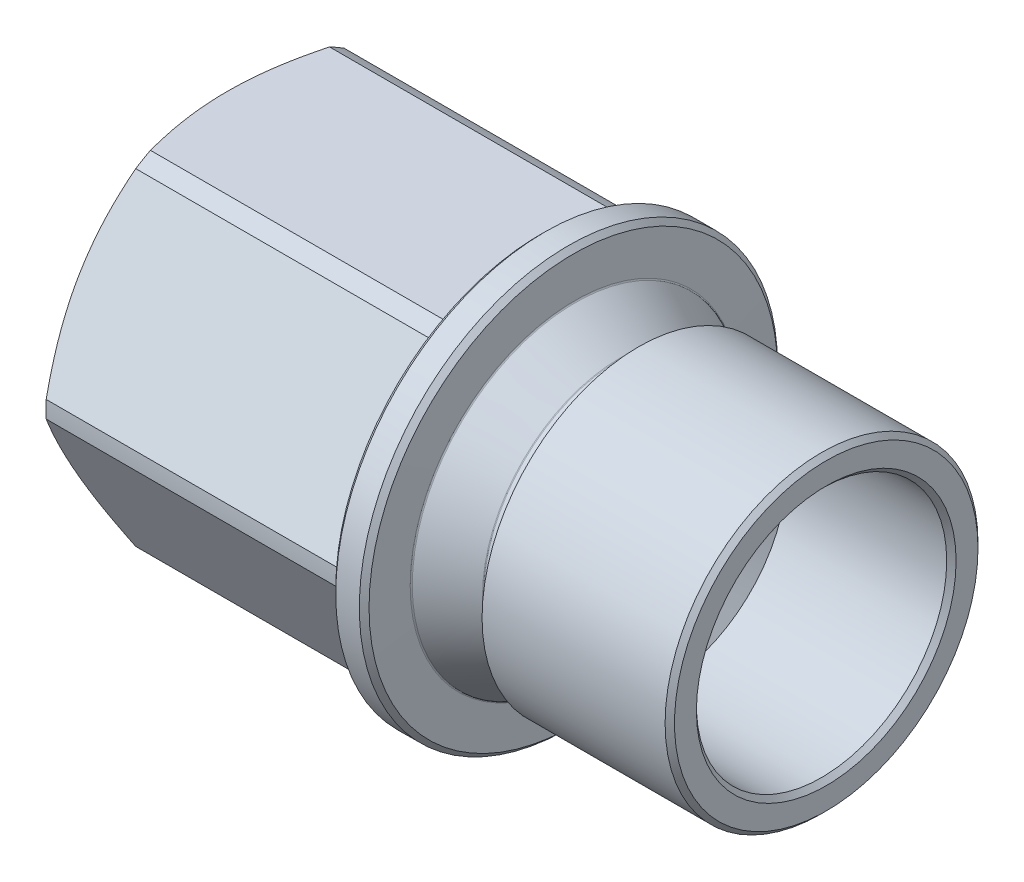
from build123d import *
from OCP.BRepFilletAPI import BRepFilletAPI_MakeChamfer

# Parameters (mm, degrees)
ESTRUSIONE_ESTRUSIONE1_DEPTH = 20
FORO_16_0_16_1_D             = 16
FORO_16_0_16_1_DEPTH         = 10.5
FORO_16_0_16_1_TIP           = 4.99999996
SMUSSO1_SIZE                 = 0.3
SMUSSO2_SIZE                 = 0.808290377
SMUSSO2_SIZE_2               = 1.4
RACCORDO1_R                  = 0.1
SMUSSO3_SIZE                 = 0.3
SMUSSO3_SIZE2                = 0.311044787
SCHIZZO5_R                   = 5.05
TAGLIO_ESTRUSIONE1_DEPTH     = 10
TAGLIO_ESTRUSIONE1_DRAFT     = -1
SCHIZZO6_R                   = 1
TAGLIO_ESTRUSIONE2_DEPTH     = 5
TAGLIO_ESTRUSIONE3_REACH     = 31.993
SCHIZZO7_R                   = 6


with BuildPart() as part:
    # Schizzo1 → Rivoluzione1 (revolve)
    with BuildSketch(Plane.XY, mode=Mode.PRIVATE) as rivoluzione1_sk:
        Polygon((0, 13.369648388), (0, 0), (18.282401556, 0), (18.282401556, 10), (6.282401556, 10), (5.577169622, 8.778502459), (5.12572234, 8.778502459), (2.207521234, 10.463326653), (2.106030242, 13.369648388), align=None)
    revolve(rivoluzione1_sk.sketch.rotate(Axis((0, 0, 0), (1, 0, 0)), 270), axis=Axis((0, 0, 0), (1, 0, 0)))

    # Schizzo2 → Estrusione-Estrusione1 (add)
    with BuildSketch(Plane.ZY):
        with BuildLine():
            Line((5.723635209, -11), (-5.723635209, -11))
            ThreePointArc((-5.723635209, -11), (-6.2, -10.738715007), (-6.664461837, -10.456813493))
            Line((-6.664461837, -10.456813493), (-12.388097046, -0.543186507))
            ThreePointArc((-12.388097046, -0.543186507), (-12.4, 0), (-12.388097046, 0.543186507))
            Line((-12.388097046, 0.543186507), (-6.664461837, 10.456813493))
            ThreePointArc((-6.664461837, 10.456813493), (-6.2, 10.738715007), (-5.723635209, 11))
            Line((-5.723635209, 11), (5.723635209, 11))
            ThreePointArc((5.723635209, 11), (6.2, 10.738715007), (6.664461837, 10.456813493))
            Line((6.664461837, 10.456813493), (12.388097046, 0.543186507))
            ThreePointArc((12.388097046, 0.543186507), (12.4, 0), (12.388097046, -0.543186507))
            Line((12.388097046, -0.543186507), (6.664461837, -10.456813493))
            ThreePointArc((6.664461837, -10.456813493), (6.2, -10.738715007), (5.723635209, -11))
        make_face()
    extrude(amount=ESTRUSIONE_ESTRUSIONE1_DEPTH)

    # Foro Ø16.0 (16)-1
    with Locations(Plane(origin=(18.282401556, 0, 0), x_dir=(0, 0, -1), z_dir=(1, 0, 0))):
        with Locations((0, 0)):
            Hole(FORO_16_0_16_1_D / 2, depth=FORO_16_0_16_1_DEPTH)
            with Locations((0, 0, -(FORO_16_0_16_1_DEPTH + FORO_16_0_16_1_TIP / 2))):  # 115.989234° drill point
                Cone(0, FORO_16_0_16_1_D / 2, FORO_16_0_16_1_TIP, mode=Mode.SUBTRACT)

    # Smusso1
    smusso1_edges = [part.edges().sort_by_distance(p)[0] for p in [
        (0, 0, 13.369648388),
        (18.282401556, 0, -8),
        (18.282401556, 0, 10),
    ]]
    chamfer(smusso1_edges, length=SMUSSO1_SIZE)

    # Smusso2
    smusso2_edges_1 = [part.edges().sort_by_distance(p)[0] for p in [
        (-20, -10.738715007, -6.2),
    ]]
    smusso2_side_1 = [part.faces().sort_by_distance(p)[0] for p in [
        (-19.983834192, -10.738715007, -6.2),
    ]]
    smusso2_edges_2 = [part.edges().sort_by_distance(p)[0] for p in [
        (-20, 0, -12.4),
    ]]
    smusso2_side_2 = [part.faces().sort_by_distance(p)[0] for p in [
        (-19.983834192, 0, -12.4),
    ]]
    smusso2_edges_3 = [part.edges().sort_by_distance(p)[0] for p in [
        (-20, -10.738715007, 6.2),
    ]]
    smusso2_side_3 = [part.faces().sort_by_distance(p)[0] for p in [
        (-19.983834192, -10.738715007, 6.2),
    ]]
    smusso2_edges_4 = [part.edges().sort_by_distance(p)[0] for p in [
        (-20, 0, 12.4),
    ]]
    smusso2_side_4 = [part.faces().sort_by_distance(p)[0] for p in [
        (-19.983834192, 0, 12.4),
    ]]
    smusso2_edges_5 = [part.edges().sort_by_distance(p)[0] for p in [
        (-20, 10.738715007, 6.2),
    ]]
    smusso2_side_5 = [part.faces().sort_by_distance(p)[0] for p in [
        (-19.983834192, 10.738715007, 6.2),
    ]]
    smusso2_edges_6 = [part.edges().sort_by_distance(p)[0] for p in [
        (-20, 10.738715007, -6.2),
    ]]
    smusso2_side_6 = [part.faces().sort_by_distance(p)[0] for p in [
        (-19.983834192, 10.738715007, -6.2),
    ]]
    smusso2 = BRepFilletAPI_MakeChamfer(part.part.solid().wrapped)
    for e in smusso2_edges_1:
        smusso2.Add(SMUSSO2_SIZE - 0.0001, SMUSSO2_SIZE_2 - 0.0001, e.wrapped, smusso2_side_1[0].wrapped)
    for e in smusso2_edges_2:
        smusso2.Add(SMUSSO2_SIZE - 0.0001, SMUSSO2_SIZE_2 - 0.0001, e.wrapped, smusso2_side_2[0].wrapped)
    for e in smusso2_edges_3:
        smusso2.Add(SMUSSO2_SIZE - 0.0001, SMUSSO2_SIZE_2 - 0.0001, e.wrapped, smusso2_side_3[0].wrapped)
    for e in smusso2_edges_4:
        smusso2.Add(SMUSSO2_SIZE - 0.0001, SMUSSO2_SIZE_2 - 0.0001, e.wrapped, smusso2_side_4[0].wrapped)
    for e in smusso2_edges_5:
        smusso2.Add(SMUSSO2_SIZE - 0.0001, SMUSSO2_SIZE_2 - 0.0001, e.wrapped, smusso2_side_5[0].wrapped)
    for e in smusso2_edges_6:
        smusso2.Add(SMUSSO2_SIZE - 0.0001, SMUSSO2_SIZE_2 - 0.0001, e.wrapped, smusso2_side_6[0].wrapped)
    add(Compound.cast(smusso2.Shape()), mode=Mode.REPLACE)  # a hair under: the kernel refuses the full size

    # Raccordo1
    raccordo1_edges = [part.edges().sort_by_distance(p)[0] for p in [
        (2.207521234, 0, 10.463326653),
        (5.12572234, 0, 8.778502459),
        (5.577169622, 0, 8.778502459),
    ]]
    fillet(raccordo1_edges, radius=RACCORDO1_R)

    # Smusso3
    smusso3_edges = [part.edges().sort_by_distance(p)[0] for p in [
        (2.106030242, 0, 13.369648388),
    ]]
    smusso3_side = [part.faces().sort_by_distance(p)[0] for p in [
        (1.203015121, 0, 13.369648388),
    ]]
    chamfer(smusso3_edges, length=SMUSSO3_SIZE, length2=SMUSSO3_SIZE2, reference=smusso3_side[0])


with BuildPart() as taglio_estrusione1_tool:
    # Schizzo5 → Taglio-Estrusione1 (with draft: the straight prism first)
    with BuildSketch(Plane.ZY.offset(20)):
        Circle(SCHIZZO5_R)
    extrude(amount=-TAGLIO_ESTRUSIONE1_DEPTH)
    # Taglio-Estrusione1: the draft: its side faces are tilted about the plane it starts from
    taglio_estrusione1_sides = [taglio_estrusione1_tool.faces().sort_by_distance(p)[0] for p in [
        (-15, 0, -5.05),
    ]]
    draft(taglio_estrusione1_sides, Plane.ZY.offset(20), TAGLIO_ESTRUSIONE1_DRAFT)


with BuildPart() as part_1:
    add(part.part)

    # Taglio-Estrusione1: cut by taglio_estrusione1_tool
    add(taglio_estrusione1_tool.part, mode=Mode.SUBTRACT)

    # Schizzo6 → Taglio-Estrusione2 (cut)
    with BuildSketch(Plane.ZY.offset(10)):
        Circle(SCHIZZO6_R)
    extrude(amount=-TAGLIO_ESTRUSIONE2_DEPTH, mode=Mode.SUBTRACT)

    # Taglio-Estrusione3: up to this cone (the profile starts outside it)
    taglio_estrusione3_end = Plane(origin=(-5, 0, 0), z_dir=(1, 0, 0)).offset(7.782402556) * Cone(1.6e-06, 39.536957511, 24.710597444, align=(Align.CENTER, Align.CENTER, Align.MIN), mode=Mode.PRIVATE)
    # Schizzo7 → Taglio-Estrusione3 (cut, up to the surface)
    with BuildSketch(Plane.ZY.offset(5), mode=Mode.PRIVATE) as taglio_estrusione3_sk1:
        Circle(SCHIZZO7_R)
    taglio_estrusione3_tool1 = extrude(taglio_estrusione3_sk1.sketch, amount=-TAGLIO_ESTRUSIONE3_REACH, mode=Mode.PRIVATE) - taglio_estrusione3_end
    add(taglio_estrusione3_tool1.solids().sort_by_distance((-5, 0, 0))[0], mode=Mode.SUBTRACT)


solid = part_1.part
